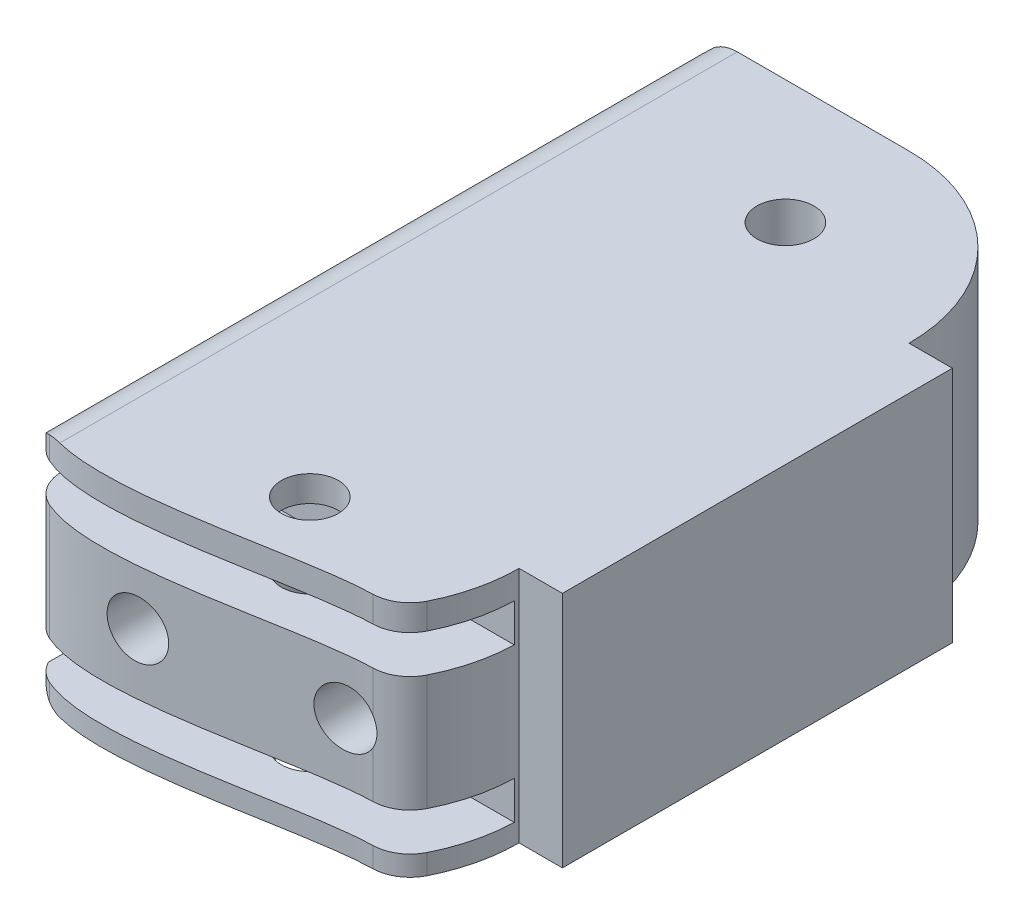
from build123d import *
from OCP.BRepAlgoAPI import BRepAlgoAPI_Cut
from OCP.TopTools import TopTools_ListOfShape

# Parameters (mm, degrees)
SKETCH1_W               = 22.054431489
SKETCH1_H               = 12.5
BOSS_EXTRUDE1_DEPTH     = 40
CUT_EXTRUDE1_DEPTH      = 10
CUT_EXTRUDE1_DEPTH_BACK = 15
SKETCH2_R               = 1.5
FILLET3_START           = -1
FILLET3_DEPTH           = 36.616951747
FILLET3_START_2         = -31
FILLET3_2_DEPTH         = 14
SKETCH5_R               = 1.5
CUT_EXTRUDE4_DEPTH      = 53.866443736
SKETCH16_W              = 22.05443149
SKETCH16_H              = 2
CUT_EXTRUDE6_DEPTH      = 8.5
FILLET4_R               = 2


with BuildPart() as part:
    # Sketch1 → Boss-Extrude1 (new body)
    with BuildSketch(Plane.XY):
        with Locations((-13.228930986, -24.070183414)):
            Rectangle(SKETCH1_W, SKETCH1_H)
    extrude(amount=BOSS_EXTRUDE1_DEPTH)

    # Sketch2 → Cut-Extrude1 (cut, two sides: drawn at the far end of the back side and taken through both)
    with BuildSketch(Plane.XZ.offset(30.320183414).offset(-CUT_EXTRUDE1_DEPTH_BACK)):
        with Locations(Location((-13.228930986, 6.5, 0), (0, 0, 90))):
            Circle(SKETCH2_R)
        with Locations(Location((-13.228930986, 31.5, 0), (0, 0, 90))):
            Circle(SKETCH2_R)
        with BuildLine():
            Line((-4.478930986, 29.25), (-2.201715242, 29.25))
            add(Edge.make_bspline(
                [(-24.256146731, 29.25), (-34.277912729, 38.417119108), (-13.227499763, 50.308047167), (7.840407292, 38.416977249), (-2.201715242, 29.25)],
                knots=[0, 0, 0, 0, 0.49986218, 1, 1, 1, 1], degree=3))
            add(Edge.make_bspline(
                [(-6.103895584, 34.329012749), (-10.720559386, 33.527203043), (-28.641384523, 40.845191705), (-24.256146731, 29.25)],
                knots=[0, 0, 0, 0, 1, 1, 1, 1], degree=3))
            ThreePointArc((-6.103895584, 34.329012749), (-4.895067543, 31.916312081), (-4.478930986, 29.25))
        make_face()
        with BuildLine():
            Line((-4.478930986, 8.75), (-2.201715242, 8.75))
            add(Edge.make_bspline(
                [(-2.201715242, 8.75), (5.39210746, 3.880294823), (-0.777052631, -4.523329032), (-17.174300591, -10.623347238), (-34.821400648, -0.026005424), (-24.256146731, 8.75)],
                knots=[0, 0, 0, 0, 0.283272691, 0.504244858, 1, 1, 1, 1], degree=3))
            add(Edge.make_bspline(
                [(-23.490579314, 0), (-24.966512963, 4.237786421), (-24.256146731, 8.75)],
                knots=[0, 0, 0, 1, 1, 1], degree=2))
            Line((-23.490579314, 0), (-13.228930986, 0))
            ThreePointArc((-13.228930986, 0), (-7.041746651, 2.562815665), (-4.478930986, 8.75))
        make_face()
    extrude(amount=CUT_EXTRUDE1_DEPTH + CUT_EXTRUDE1_DEPTH_BACK, mode=Mode.SUBTRACT)


with BuildPart() as fillet3_tool:
    # Fillet3: read off the stored shape, not the designer's step
    # Fillet3 outline → Fillet3 (new body)
    with BuildSketch(Plane.XY.offset(FILLET3_START)):
        with BuildLine():
            Line((-24.256146731, -17.820183414), (-24.256146731, -19.820183414))
            ThreePointArc((-24.256146731, -19.820183414), (-23.670360293, -18.405969851), (-22.256146731, -17.820183414))
            Line((-22.256146731, -17.820183414), (-24.256146731, -17.820183414))
        make_face()
        with BuildLine():
            ThreePointArc((-22.256146731, -30.320183414), (-23.670360293, -29.734396976), (-24.256146731, -28.320183414))
            Line((-24.256146731, -28.320183414), (-24.256146731, -30.320183414))
            Line((-24.256146731, -30.320183414), (-22.256146731, -30.320183414))
        make_face()
    extrude(amount=FILLET3_DEPTH)


with BuildPart() as part_1:
    add(part.part)

    # Fillet3: cut by fillet3_tool, with a tolerance
    fillet3_stock = TopTools_ListOfShape()
    fillet3_stock.Append(part_1.part.wrapped)
    fillet3_tools = TopTools_ListOfShape()
    fillet3_tools.Append(fillet3_tool.part.wrapped)
    fillet3_cut = BRepAlgoAPI_Cut()
    fillet3_cut.SetArguments(fillet3_stock)
    fillet3_cut.SetTools(fillet3_tools)
    fillet3_cut.SetFuzzyValue(0.00001)
    fillet3_cut.Build()
    add(Compound.cast(fillet3_cut.Shape()).solids(), mode=Mode.REPLACE)


with BuildPart() as fillet3_2_tool:
    # Fillet3 2 outline → Fillet3 2 (new body)
    with BuildSketch(Plane(origin=(0, 0, 0), x_dir=(1, 0, 0), z_dir=(0, 1, 0)).offset(FILLET3_START_2)):
        with BuildLine():
            Line((-24.256146731, -3.001504812), (-24.256146731, -3.16929397))
            ThreePointArc((-24.256146731, -3.16929397), (-24.248700679, -2.996873655), (-24.226417966, -2.82573719))
            add(Edge.make_bspline(
                [(-24.226417966, -2.82573719), (-24.241732441, -2.913564505), (-24.256146731, -3.001504812)],
                knots=[0.329874436, 0.329874436, 0.329874436, 0.350165787, 0.350165787, 0.350165787], degree=2))
        make_face()
        with BuildLine():
            ThreePointArc((-23.055175533, -35.347858737), (-23.929176558, -34.610293214), (-24.256146731, -33.5144049))
            Line((-24.256146731, -33.5144049), (-24.256146731, -34.486377393))
            add(Edge.make_bspline(
                [(-24.256146731, -34.486377393), (-23.945543724, -34.85491353), (-23.538709887, -35.137131928), (-23.055175533, -35.347858737)],
                knots=[0.223074816, 0.223074816, 0.223074816, 0.223074816, 0.304929745, 0.304929745, 0.304929745, 0.304929745], degree=3))
        make_face()
    extrude(amount=FILLET3_2_DEPTH)


with BuildPart() as part_2:
    add(part_1.part)

    # Fillet3 2: cut by fillet3_2_tool, with a tolerance
    fillet3_2_stock = TopTools_ListOfShape()
    fillet3_2_stock.Append(part_2.part.wrapped)
    fillet3_2_tools = TopTools_ListOfShape()
    fillet3_2_tools.Append(fillet3_2_tool.part.wrapped)
    fillet3_2_cut = BRepAlgoAPI_Cut()
    fillet3_2_cut.SetArguments(fillet3_2_stock)
    fillet3_2_cut.SetTools(fillet3_2_tools)
    fillet3_2_cut.SetFuzzyValue(0.00001)
    fillet3_2_cut.Build()
    add(Compound.cast(fillet3_2_cut.Shape()).solids(), mode=Mode.REPLACE)

    # Sketch5 → Cut-Extrude4 (cut, through all)
    with BuildSketch(Plane.XY):
        with Locations(Location((-18.011106811, -24.070183414, 0), (0, 0, 180))):
            Circle(SKETCH5_R)
        with Locations(Location((-8.446755162, -24.070183414, 0), (0, 0, 180))):
            Circle(SKETCH5_R)
    extrude(amount=CUT_EXTRUDE4_DEPTH, mode=Mode.SUBTRACT)

    # Sketch16 → Cut-Extrude6 (cut)
    with BuildSketch(Plane.XY.offset(38)):
        with Locations((-13.228930985, -20.1809771)):
            Rectangle(SKETCH16_W, SKETCH16_H)
        with Locations((-13.228930985, -28.261916897)):
            Rectangle(SKETCH16_W, SKETCH16_H)
    extrude(amount=-CUT_EXTRUDE6_DEPTH, mode=Mode.SUBTRACT)

    # Fillet4
    # the kernel refuses this fillet: 2 mm, written as the material it takes off along each edge
    with BuildSketch(Plane(origin=(-6.103895584, -22.583679851, 34.329012749), x_dir=(0.5153680546007453, 0, -0.8569689424343471), z_dir=(0, 1, 0))) as fillet4_piece_1:
        with BuildLine():
            CenterArc((1.205528974, 1.993941708), FILLET4_R, 212.228268917, 62.232476225)
            Line((-0.486331325, 0.927354287), (-0.520168531, 0.906022538))
            ThreePointArc((-0.520168531, 0.906022538), (-0.25689069, 0.456334761), (-0.037300681, -0.01444504))
            Line((-0.037300681, -0.01444504), (-0.003111043, -0.039878834))
            ThreePointArc((-0.003111043, -0.039878834), (0.68054055, -0.066505026), (1.364192143, -0.039878834))
            Line((1.364192143, -0.039878834), (1.3610811, 0))
        make_face()
    extrude(amount=8.166199187, mode=Mode.SUBTRACT)
    with BuildSketch(Plane(origin=(-6.103895584, -30.664619647, 34.329012749), x_dir=(0.5153680546007453, 0, -0.8569689424343471), z_dir=(0, 1, 0))) as fillet4_piece_2:
        with BuildLine():
            CenterArc((1.205528974, 1.993941708), FILLET4_R, 212.228268917, 62.232476225)
            Line((-0.486331325, 0.927354287), (-0.520168531, 0.906022538))
            ThreePointArc((-0.520168531, 0.906022538), (-0.25689069, 0.456334761), (-0.037300681, -0.01444504))
            Line((-0.037300681, -0.01444504), (-0.003111043, -0.039878834))
            ThreePointArc((-0.003111043, -0.039878834), (0.68054055, -0.066505026), (1.364192143, -0.039878834))
            Line((1.364192143, -0.039878834), (1.3610811, 0))
        make_face()
    extrude(amount=12.886345297, mode=Mode.SUBTRACT)
    with BuildSketch(Plane(origin=(-6.103895584, -33.722886164, 34.329012749), x_dir=(0.5153680546007453, 0, -0.8569689424343471), z_dir=(0, 1, 0))) as fillet4_piece_3:
        with BuildLine():
            CenterArc((1.205528974, 1.993941708), FILLET4_R, 212.228268917, 62.232476225)
            Line((-0.486331325, 0.927354287), (-0.520168531, 0.906022538))
            ThreePointArc((-0.520168531, 0.906022538), (-0.25689069, 0.456334761), (-0.037300681, -0.01444504))
            Line((-0.037300681, -0.01444504), (-0.003111043, -0.039878834))
            ThreePointArc((-0.003111043, -0.039878834), (0.68054055, -0.066505026), (1.364192143, -0.039878834))
            Line((1.364192143, -0.039878834), (1.3610811, 0))
        make_face()
    extrude(amount=7.863672018, mode=Mode.SUBTRACT)


solid = part_2.part
